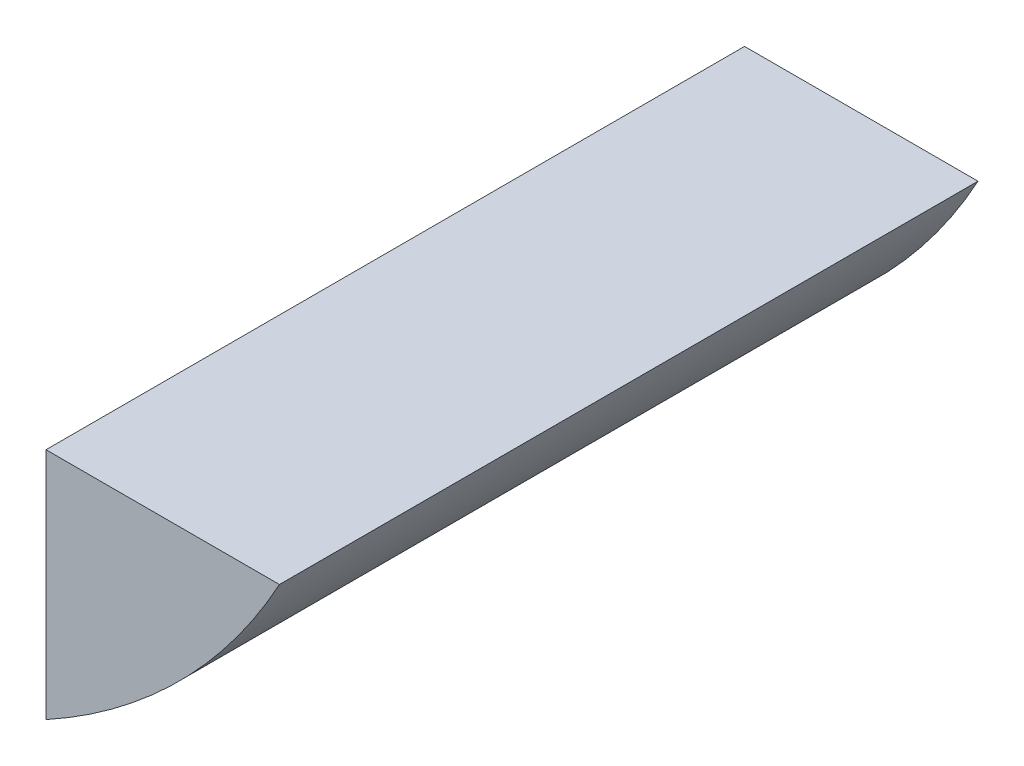
from build123d import *

# Parameters (mm, degrees)
DODANIE_WYCI_GNI_CIE1_DEPTH = 50


with BuildPart() as part:
    # Szkic1 → Dodanie-wyciągnięcie1 (new body)
    with BuildSketch(Plane.XY):
        with BuildLine():
            Line((32.959582694, -19.181460051), (16.25, -19.181460051))
            Line((16.25, -19.181460051), (16.25, -35.910117685))
            ThreePointArc((16.25, -35.910117685), (25.803307843, -28.742938749), (32.959582694, -19.181460051))
        make_face()
    extrude(amount=DODANIE_WYCI_GNI_CIE1_DEPTH)


solid = part.part
